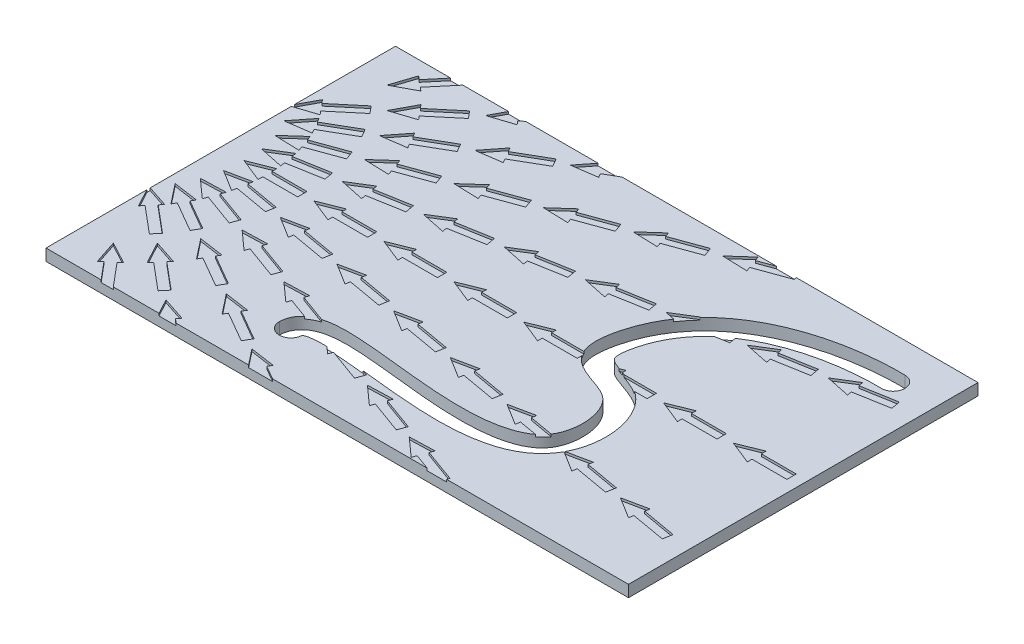
from build123d import *

# Parameters (mm, degrees)
SKETCH1_W           = 250
SKETCH1_H           = 150
BOSS_EXTRUDE1_DEPTH = 5
CUT_EXTRUDE1_DEPTH  = 5
CUT_EXTRUDE2_START  = -1
CUT_EXTRUDE2_DEPTH  = 1


with BuildPart() as part:
    # Sketch1 → Boss-Extrude1 (new body)
    with BuildSketch(Plane(origin=(0, 0, 0), x_dir=(1, 0, 0), z_dir=(0, 1, 0))):
        with Locations((125, 75)):
            Rectangle(SKETCH1_W, SKETCH1_H)
    extrude(amount=BOSS_EXTRUDE1_DEPTH)

    # Sketch2 → Cut-Extrude1 (cut)
    with BuildSketch(Plane(origin=(0, 5, 0), x_dir=(1, 0, 0), z_dir=(0, 1, 0))):
        with BuildLine():
            ThreePointArc((231.61710141, 137.091103579), (236.518031245, 131.993958618), (231.420886284, 127.093028783))
            add(Edge.make_bspline(
                [(87.442840172, 22.509890702), (87.487219031, 22.538190531), (87.56621479, 22.584696112), (87.827422152, 22.717359182), (88.287514716, 22.9020172), (89.065572304, 23.127706573), (90.372810728, 23.396871515), (92.465860574, 23.637593092), (95.573983515, 23.733453325), (99.176449285, 23.646591019), (104.532005608, 23.320637471), (112.090947152, 22.598339386), (122.08745105, 21.508602295), (132.608990719, 20.487710634), (143.282459547, 19.831860198), (153.761513305, 19.846866197), (163.733448325, 20.866587442), (172.918476316, 23.290002587), (179.662158822, 26.964522368), (184.136042107, 31.208134735), (186.879230201, 35.057793714), (188.858688881, 39.508991935), (190.44576648, 45.855425588), (190.599412807, 52.607620038), (189.259574387, 59.240222486), (187.44575277, 64.014850272), (184.735723774, 68.416882089), (181.658916356, 71.581803024), (178.676867784, 73.636507694), (175.663841365, 75.240113938), (171.94608779, 76.695476939), (167.93700209, 78.060647412), (165.340846704, 79.146293913), (163.979420147, 79.970073573), (163.351189328, 80.501180616), (163.097772973, 80.83271359), (162.977215406, 81.051648061), (162.83545725, 81.399278426), (162.663196277, 82.113004035), (162.545662643, 83.788475743), (162.819658934, 86.603081225), (163.69259771, 90.389209784), (164.808164107, 93.893577844), (166.181177959, 97.176411096), (168.329704732, 101.263499088), (171.59280903, 105.87458871), (176.377255805, 110.702840287), (181.976860588, 114.885088668), (188.261754501, 118.42923196), (195.084610518, 121.343286487), (202.285096223, 123.640833241), (209.696069567, 125.342781465), (217.151884654, 126.47614145), (223.249999016, 126.973642276), (227.996363637, 127.121190528), (230.271419529, 127.115587403), (231.420886284, 127.093028783)],
                knots=[0.038993346, 0.038993346, 0.038993346, 0.038993346, 0.042747279, 0.046501211, 0.054009075, 0.06151694, 0.069024804, 0.084040533, 0.099056262, 0.114071991, 0.12908772, 0.159119178, 0.189150636, 0.219182094, 0.249213552, 0.27924501, 0.309276468, 0.339307926, 0.369339384, 0.384355112, 0.399370841, 0.41438657, 0.429402299, 0.459433757, 0.474449486, 0.489465215, 0.504480944, 0.519496673, 0.527004538, 0.534512402, 0.549528131, 0.56454386, 0.579559589, 0.587067454, 0.594575318, 0.602083182, 0.605837115, 0.609591047, 0.617098911, 0.624606776, 0.639622505, 0.654638234, 0.669653963, 0.684669692, 0.699685421, 0.729716879, 0.759748337, 0.789779795, 0.819811252, 0.84984271, 0.879874168, 0.909905626, 0.939937084, 0.969968542, 0.984984271, 1, 1, 1, 1], degree=3))
            ThreePointArc((87.442840172, 22.509890702), (82.329944346, 17.666936074), (77.445826809, 22.740525448))
            add(Edge.make_bspline(
                [(77.445826809, 22.740525448), (77.455755423, 23.403070297), (77.591760105, 24.720503893), (78.212448221, 26.673715282), (79.24137383, 28.431958212), (81.016765739, 30.363871292), (83.623698353, 31.940566685), (86.915199553, 32.973245021), (90.43142147, 33.518210862), (95.497644292, 33.798718834), (102.604960401, 33.533375863), (112.221763723, 32.6429675), (122.583760686, 31.51122596), (133.290821763, 30.462440362), (143.906139272, 29.813640455), (153.962448048, 29.871546733), (162.952933932, 30.908137592), (170.331820224, 33.117035705), (174.732767699, 35.896577437), (177.260870428, 38.697413514), (178.723620073, 41.171661011), (179.806638044, 44.274523793), (180.603590634, 48.984209305), (180.294712228, 54.067762024), (178.865612976, 58.606400519), (177.297652123, 61.532586721), (175.615998834, 63.470764145), (174.1056628, 64.668044072), (172.290605661, 65.757881543), (169.333985736, 67.014569854), (165.184979107, 68.429036339), (161.53508308, 69.841253839), (158.629030086, 71.470627316), (156.512495882, 73.102809649), (154.939803267, 74.930367804), (153.936269786, 76.711912936), (153.197001887, 78.552939141), (152.69886888, 80.844429693), (152.552143018, 83.525190353), (152.711024567, 86.137025118), (153.08241254, 88.67752822), (153.597439343, 91.120801622), (154.399871268, 94.227505762), (155.636722465, 97.967367837), (157.472636774, 102.182550777), (159.641909635, 106.131981052), (162.947948335, 111.037042342), (167.796207662, 116.493868569), (174.55443606, 121.994528656), (182.023503291, 126.515451009), (190.010674064, 130.139975222), (198.337843451, 132.943176636), (206.834596363, 134.992342492), (215.338154197, 136.346965767), (222.28274501, 136.941990064), (227.695925115, 137.121511369), (230.301910183, 137.116914589), (231.61710141, 137.091103579)],
                knots=[0, 0, 0, 0, 0.0078125, 0.015625, 0.0234375, 0.03125, 0.046875, 0.0625, 0.078125, 0.09375, 0.125, 0.15625, 0.1875, 0.21875, 0.25, 0.28125, 0.3125, 0.34375, 0.375, 0.390625, 0.40625, 0.421875, 0.4375, 0.46875, 0.484375, 0.5, 0.515625, 0.5234375, 0.53125, 0.546875, 0.5625, 0.578125, 0.5859375, 0.59375, 0.6015625, 0.60546875, 0.609375, 0.6171875, 0.625, 0.6328125, 0.640625, 0.6484375, 0.65625, 0.671875, 0.6875, 0.703125, 0.71875, 0.75, 0.78125, 0.8125, 0.84375, 0.875, 0.90625, 0.9375, 0.96875, 0.984375, 1, 1, 1, 1], degree=3))
        make_face()
    extrude(amount=-CUT_EXTRUDE1_DEPTH, mode=Mode.SUBTRACT)

    # Cut-Extrude2: read off the stored shape, not the designer's step
    # Cut-Extrude2 outline → Cut-Extrude2 (cut)
    with BuildSketch(Plane(origin=(0, 5, 0), x_dir=(1, 0, 0), z_dir=(0, 1, 0)).offset(CUT_EXTRUDE2_START)):
        Polygon((10, 75), (20, 71), (20, 73), (35, 73), (35, 77), (20, 77), (20, 79), align=None)
        with BuildLine():
            Line((185, 73), (185, 77))
            Line((185, 77), (171.005312835, 77))
            add(Edge.make_bspline(
                [(179.575819253, 72.999999994), (179.277240227, 73.201829463), (178.227611628, 73.875612792), (175.663841365, 75.240113938), (173.071317409, 76.254991166), (171.338857931, 76.880563135), (171.005312835, 77)],
                knots=[0.523974502, 0.523974502, 0.523974502, 0.523974502, 0.527004538, 0.534512402, 0.549528131, 0.553182064, 0.553182064, 0.553182064, 0.553182064], degree=3))
            Line((179.575819253, 72.999999994), (185, 73))
        make_face()
        with BuildLine():
            Line((115.935437724, 21.592312762), (113.682153655, 22.412441093))
            add(Edge.make_bspline(
                [(96.870128329, 23.693401954), (97.630578367, 23.680803521), (99.648744068, 23.61784589), (104.532005608, 23.320637471), (109.51986832, 22.844019989), (113.199876856, 22.46274311), (113.682153655, 22.412441093)],
                knots=[0.104353079, 0.104353079, 0.104353079, 0.104353079, 0.114071991, 0.12908772, 0.159119178, 0.16361358, 0.16361358, 0.16361358, 0.16361358], degree=3))
            Line((96.870128329, 23.693401954), (99.787927552, 21.084459188))
            Line((99.787927552, 21.084459188), (100.471967839, 22.963844429))
            Line((100.471967839, 22.963844429), (114.567357151, 17.833542279))
            Line((114.567357151, 17.833542279), (115.935437724, 21.592312762))
        make_face()
        with BuildLine():
            Line((197.099368946, 37.845635343), (187.078813451, 35.751974965))
            add(Edge.make_bspline(
                [(186.903224876, 35.428018977), (186.962510048, 35.535437036), (187.021040216, 35.643429775), (187.078813451, 35.751974965)],
                knots=[0.400343041, 0.400343041, 0.400343041, 0.400343041, 0.401498247, 0.401498247, 0.401498247, 0.401498247], degree=3))
            Line((186.903224876, 35.428018977), (195.710183525, 29.967173319))
            Line((195.710183525, 29.967173319), (196.05747988, 31.936788825))
            Line((196.05747988, 31.936788825), (210.829596175, 29.33206616))
            Line((210.829596175, 29.33206616), (211.524188886, 33.271297172))
            Line((211.524188886, 33.271297172), (196.752072591, 35.876019837))
            Line((196.752072591, 35.876019837), (197.099368946, 37.845635343))
        make_face()
        with BuildLine():
            add(Edge.make_bspline(
                [(176.455574302, 110.545159902), (176.474737969, 110.56184422), (178.043216805, 111.925121766), (179.723478024, 113.199813081), (181.476688581, 114.373430548)],
                knots=[0.75941522, 0.75941522, 0.75941522, 0.75941522, 0.759748337, 0.786655892, 0.786655892, 0.786655892, 0.786655892], degree=3))
            Line((176.455574302, 110.545159902), (181.979956296, 111.519257498))
            Line((181.979956296, 111.519257498), (181.476688581, 114.373430548))
        make_face()
        with BuildLine():
            add(Edge.make_bspline(
                [(170, 77.358011648), (169.330011545, 77.596073721), (168.604050588, 77.854687), (167.927297886, 78.109864747), (167.849003507, 78.139601398)],
                knots=[0.556920564, 0.556920564, 0.556920564, 0.556920564, 0.56454386, 0.56555125, 0.56555125, 0.56555125, 0.56555125], degree=3))
            Line((170, 77.358011648), (170, 79))
            Line((170, 79), (167.849003507, 78.139601398))
        make_face()
        with BuildLine():
            add(Edge.make_bspline(
                [(155.000000026, 74.977141887), (154.900999676, 75.115744229), (154.524854203, 75.667015359), (154.135483583, 76.358254211), (153.880971374, 76.906181092), (153.838866754, 77)],
                knots=[0.60021075, 0.60021075, 0.60021075, 0.60021075, 0.6015625, 0.60546875, 0.606273244, 0.606273244, 0.606273244, 0.606273244], degree=3))
            Line((153.838866754, 77), (140, 77))
            Line((140, 77), (140, 79))
            Line((140, 79), (130, 75))
            Line((130, 75), (140, 71))
            Line((140, 71), (140, 73))
            Line((140, 73), (155, 73))
            Line((155, 73), (155.000000026, 74.977141887))
        make_face()
        with BuildLine():
            add(Edge.make_bspline(
                [(80.899163708, 30.087762534), (81.758277369, 30.810569981), (83.366990767, 31.757640493), (85.040078744, 32.365698931), (85.754322662, 32.577340275)],
                knots=[0.032896923, 0.032896923, 0.032896923, 0.032896923, 0.046875, 0.056935937, 0.056935937, 0.056935937, 0.056935937], degree=3))
            Line((85.754322662, 32.577340275), (73.649269789, 36.983219212))
            Line((73.649269789, 36.983219212), (74.333310075, 38.862604454))
            Line((74.333310075, 38.862604454), (63.568303294, 38.524035404))
            Line((63.568303294, 38.524035404), (71.597148929, 31.345063487))
            Line((71.597148929, 31.345063487), (72.281189216, 33.224448729))
            Line((72.281189216, 33.224448729), (80.899163708, 30.087762534))
        make_face()
        with BuildLine():
            add(Edge.make_bspline(
                [(174.251255317, 35.78181456), (174.612248999, 36.059517755), (175.708290658, 36.977340441), (176.765473848, 38.148573232), (177.427307268, 39.092253738), (177.541663952, 39.263333192)],
                knots=[0.367866973, 0.367866973, 0.367866973, 0.367866973, 0.375, 0.390625, 0.394002758, 0.394002758, 0.394002758, 0.394002758], degree=3))
            Line((177.541663952, 39.263333192), (167.20784, 41.085465167))
            Line((167.20784, 41.085465167), (167.555136356, 43.055080673))
            Line((167.555136356, 43.055080673), (157.012466115, 40.852331437))
            Line((157.012466115, 40.852331437), (166.165950934, 35.176618649))
            Line((166.165950934, 35.176618649), (166.51324729, 37.146234155))
            Line((166.51324729, 37.146234155), (174.251255317, 35.78181456))
        make_face()
        with BuildLine():
            Line((157.012466115, 109.147668563), (161.118018294, 108.289868622))
            add(Edge.make_bspline(
                [(161.118018294, 108.289868622), (161.460189271, 108.789417087), (163.035852587, 111.001277586), (164.77369278, 113.060299338), (166.210474866, 114.57087355)],
                knots=[0.712342646, 0.712342646, 0.712342646, 0.712342646, 0.71875, 0.741149199, 0.741149199, 0.741149199, 0.741149199], degree=3))
            Line((166.210474866, 114.57087355), (166.165950934, 114.823381351))
            Line((166.165950934, 114.823381351), (157.012466115, 109.147668563))
        make_face()
        Polygon((95, 73), (95, 77), (80, 77), (80, 79), (70, 75), (80, 71), (80, 73), align=None)
        Polygon((125, 73), (125, 77), (110, 77), (110, 79), (100, 75), (110, 71), (110, 73), align=None)
        Polygon((65, 73), (65, 77), (50, 77), (50, 79), (40, 75), (50, 71), (50, 73), align=None)
        Polygon((245, 73), (245, 77), (230, 77), (230, 79), (220, 75), (230, 71), (230, 73), align=None)
        Polygon((215, 73), (215, 77), (200, 77), (200, 79), (190, 75), (200, 71), (200, 73), align=None)
        Polygon((19.486677049, 82.867308183), (34.258793344, 85.472030848), (33.564200633, 89.41126186), (18.792084338, 86.806539195), (18.444787983, 88.776154701), (9.291303163, 83.100441913), (19.833973404, 80.897692677), align=None)
        Polygon((78.575142229, 93.286198843), (93.347258524, 95.890921508), (92.652665814, 99.83015252), (77.880549519, 97.225429855), (77.533253163, 99.195045361), (68.379768344, 93.519332573), (78.922438585, 91.316583337), align=None)
        Polygon((49.030909639, 88.076753513), (63.803025934, 90.681476178), (63.108433223, 94.62070719), (48.336316928, 92.015984525), (47.989020573, 93.985600031), (38.835535753, 88.309887243), (49.378205994, 86.107138007), align=None)
        Polygon((137.66360741, 103.705089503), (152.435723705, 106.309812168), (151.741130995, 110.24904318), (136.969014699, 107.644320515), (136.621718344, 109.613936021), (127.468233525, 103.938223233), (138.010903765, 101.735473997), align=None)
        Polygon((226.296305181, 119.333425493), (241.068421476, 121.938148158), (240.373828766, 125.87737917), (225.60171247, 123.272656505), (225.254416115, 125.242272011), (216.100931296, 119.566559223), (226.643601536, 117.363809987), align=None)
        Polygon((196.752072591, 114.123980163), (211.524188886, 116.728702828), (210.829596175, 120.66793384), (196.05747988, 118.063211175), (195.710183525, 120.032826681), (186.556698705, 114.357113893), (197.099368946, 112.154364657), align=None)
        Polygon((108.11937482, 98.495644173), (122.891491115, 101.100366838), (122.196898404, 105.03959785), (107.424782109, 102.434875185), (107.077485754, 104.404490691), (97.924000934, 98.728777903), (108.466671175, 96.526028667), align=None)
        Polygon((171.927144938, 0), (172.316994971, 1.071104163), (158.22160566, 6.201406313), (158.905645946, 8.080791554), (148.140639165, 7.742222505), (156.1694848, 0.563250588), (156.853525086, 2.44263583), (163.564611872, 0), align=None)
        Polygon((171.927144938, 150), (163.564611872, 150), (156.853525086, 147.55736417), (156.1694848, 149.436749412), (148.140639165, 142.257777495), (158.905645946, 141.919208446), (158.22160566, 143.798593687), (172.316994971, 148.928895837), align=None)
        Polygon((97.255224781, 150), (86.945558465, 150), (81.692560896, 143.324292893), (92.352814934, 144.860191278), (91.352814934, 146.592242086), align=None)
        Polygon((55.844381312, 150), (48.505944909, 150), (45.048970722, 143.552389534), (55.280565592, 146.916087859), (53.994990372, 148.448176745), align=None)
        Polygon((28.89470113, 150), (23.673071973, 150), (17.515962668, 142.662242865), (15.983873781, 143.947818085), (12.620175457, 133.716223215), (22.112229326, 138.805517207), (20.58014044, 140.091092427), align=None)
        Polygon((0, 106.689269202), (0, 105.285515962), (9.317899005, 108.348831277), (8.032323785, 109.880920164), (19.522990432, 119.522734309), (16.951839993, 122.586912081), (5.461173346, 112.945097936), (4.175598127, 114.477186822), align=None)
        Polygon((0, 44.714484038), (0, 43.310730798), (4.175598127, 35.522813178), (5.461173346, 37.054902064), (16.951839993, 27.413087919), (19.522990432, 30.477265691), (8.032323785, 40.119079836), (9.317899005, 41.651168723), align=None)
        Polygon((23.673071973, 0), (28.89470113, 0), (20.58014044, 9.908907573), (22.112229326, 11.194482793), (12.620175457, 16.283776785), (15.983873781, 6.052181915), (17.515962668, 7.337757135), align=None)
        Polygon((48.505944909, 0), (55.844381312, 0), (53.994990372, 1.551823255), (55.280565592, 3.083912141), (45.048970722, 6.447610466), align=None)
        Polygon((86.945558465, 0), (97.255224781, 0), (91.352814934, 3.407757914), (92.352814934, 5.139808722), (81.692560896, 6.675707107), align=None)
        Polygon((58.185799904, 38.354750879), (59.553880477, 42.113521362), (45.458491165, 47.243823512), (46.142531452, 49.123208753), (35.377524671, 48.784639704), (43.406370305, 41.605667787), (44.090410592, 43.485053029), align=None)
        Polygon((29.99502128, 48.615355179), (31.363101853, 52.374125662), (17.267712542, 57.504427812), (17.951752828, 59.383813053), (7.186746047, 59.045244003), (15.215591682, 51.866272087), (15.899631968, 53.745657329), align=None)
        Polygon((142.758135774, 7.57293798), (144.126216348, 11.331708463), (130.030827036, 16.462010613), (130.714867323, 18.341395854), (119.949860541, 18.002826804), (127.978706176, 10.823854888), (128.662746463, 12.703240129), align=None)
        Polygon((18.792084338, 63.193460805), (33.564200633, 60.58873814), (34.258793344, 64.527969152), (19.486677049, 67.132691817), (19.833973404, 69.102307323), (9.291303163, 66.899558087), (18.444787983, 61.223845299), align=None)
        Polygon((48.336316928, 57.984015475), (63.108433223, 55.37929281), (63.803025934, 59.318523822), (49.030909639, 61.923246487), (49.378205994, 63.892861993), (38.835535753, 61.690112757), (47.989020573, 56.014399969), align=None)
        Polygon((77.880549519, 52.774570145), (92.652665814, 50.16984748), (93.347258524, 54.109078492), (78.575142229, 56.713801157), (78.922438585, 58.683416663), (68.379768344, 56.480667427), (77.533253163, 50.804954639), align=None)
        Polygon((107.424782109, 47.565124815), (122.196898404, 44.96040215), (122.891491115, 48.899633162), (108.11937482, 51.504355827), (108.466671175, 53.473971333), (97.924000934, 51.271222097), (107.077485754, 45.595509309), align=None)
        Polygon((136.969014699, 42.355679485), (151.741130995, 39.75095682), (152.435723705, 43.690187832), (137.66360741, 46.294910497), (138.010903765, 48.264526003), (127.468233525, 46.061776767), (136.621718344, 40.386063979), align=None)
        Polygon((225.60171247, 26.727343495), (240.373828766, 24.12262083), (241.068421476, 28.061851842), (226.296305181, 30.666574507), (226.643601536, 32.636190013), (216.100931296, 30.433440777), (225.254416115, 24.757727989), align=None)
        Polygon((87.744659101, 118.147082938), (86.376578527, 121.905853421), (72.281189216, 116.775551271), (71.597148929, 118.654936513), (63.568303294, 111.475964596), (74.333310075, 111.137395546), (73.649269789, 113.016780788), align=None)
        Polygon((31.363101853, 97.625874338), (29.99502128, 101.384644821), (15.899631968, 96.254342671), (15.215591682, 98.133727913), (7.186746047, 90.954755997), (17.951752828, 90.616186947), (17.267712542, 92.495572188), align=None)
        Polygon((115.935437724, 128.407687238), (114.567357151, 132.166457721), (100.471967839, 127.036155571), (99.787927552, 128.915540812), (91.759081918, 121.736568896), (102.524088699, 121.397999846), (101.840048412, 123.277385088), align=None)
        Polygon((144.126216348, 138.668291537), (142.758135774, 142.42706202), (128.662746463, 137.296759871), (127.978706176, 139.176145112), (119.949860541, 131.997173196), (130.714867323, 131.658604146), (130.030827036, 133.537989387), align=None)
        Polygon((59.553880477, 107.886478638), (58.185799904, 111.645249121), (44.090410592, 106.514946971), (43.406370305, 108.394332213), (35.377524671, 101.215360296), (46.142531452, 100.876791247), (45.458491165, 102.756176488), align=None)
        Polygon((13.410528593, 101.592242086), (26.40090965, 109.092242086), (24.40090965, 112.556343701), (11.410528593, 105.056343701), (10.410528593, 106.788394508), (3.750274555, 98.324292893), (14.410528593, 99.860191278), align=None)
        Polygon((65.37205282, 131.592242086), (78.362433877, 139.092242086), (76.362433877, 142.556343701), (63.37205282, 135.056343701), (62.37205282, 136.788394508), (55.711798782, 128.324292893), (66.37205282, 129.860191278), align=None)
        Polygon((39.391290707, 116.592242086), (52.381671763, 124.092242086), (50.381671763, 127.556343701), (37.391290707, 120.056343701), (36.391290707, 121.788394508), (29.731036669, 113.324292893), (40.391290707, 114.860191278), align=None)
        Polygon((31.013657079, 129.164548454), (42.504323726, 138.8063626), (39.933173287, 141.870540372), (28.44250664, 132.228726227), (27.156931421, 133.760815113), (22.067637428, 124.268761244), (32.299232298, 127.632459568), align=None)
        Polygon((24.40090965, 37.443656299), (26.40090965, 40.907757914), (13.410528593, 48.407757914), (14.410528593, 50.139808722), (3.750274555, 51.675707107), (10.410528593, 43.211605492), (11.410528593, 44.943656299), align=None)
        Polygon((50.381671763, 22.443656299), (52.381671763, 25.907757914), (39.391290707, 33.407757914), (40.391290707, 35.139808722), (29.731036669, 36.675707107), (36.391290707, 28.211605492), (37.391290707, 29.943656299), align=None)
        Polygon((76.362433877, 7.443656299), (78.362433877, 10.907757914), (65.37205282, 18.407757914), (66.37205282, 20.139808722), (55.711798782, 21.675707107), (62.37205282, 13.211605492), (63.37205282, 14.943656299), align=None)
        Polygon((39.933173287, 8.129459628), (42.504323726, 11.1936374), (31.013657079, 20.835451546), (32.299232298, 22.367540432), (22.067637428, 25.731238756), (27.156931421, 16.239184887), (28.44250664, 17.771273773), align=None)
    extrude(amount=CUT_EXTRUDE2_DEPTH, mode=Mode.SUBTRACT)


solid = part.part
